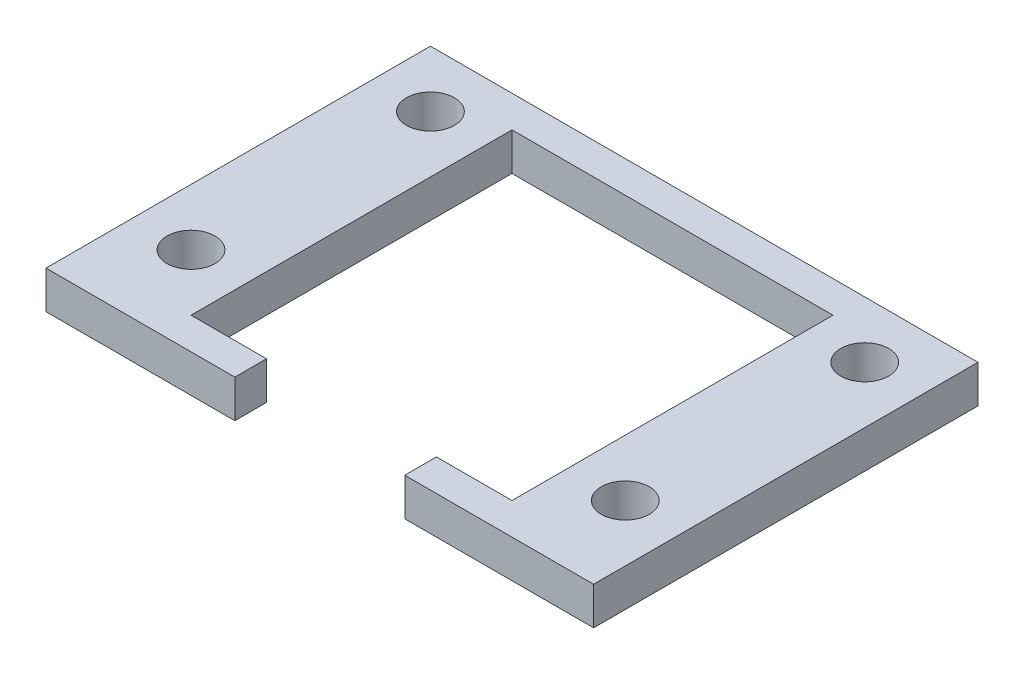
from build123d import *

# Parameters (mm, degrees)
SKETCH1_R           = 3.175
BOSS_EXTRUDE1_DEPTH = 5


with BuildPart() as part:
    # Sketch1 → Boss-Extrude1 (new body)
    with BuildSketch(Plane(origin=(0, 0, 0), x_dir=(1, 0, 0), z_dir=(0, 1, 0))):
        Polygon((-15, 46.7), (-15, -4.2), (10, -4.2), (10, 0), (0, 0), (0, 42.5), (42.5, 42.5), (42.5, 0), (32.5, 0), (32.5, -4.2), (57.5, -4.2), (57.5, 46.7), align=None)
        with Locations((-7.5, 7.5)):
            Circle(SKETCH1_R, mode=Mode.SUBTRACT)
        with Locations((50, 7.5)):
            Circle(SKETCH1_R, mode=Mode.SUBTRACT)
        with Locations((-7.5, 39.2)):
            Circle(SKETCH1_R, mode=Mode.SUBTRACT)
        with Locations((50, 39.2)):
            Circle(SKETCH1_R, mode=Mode.SUBTRACT)
    extrude(amount=BOSS_EXTRUDE1_DEPTH)


solid = part.part
